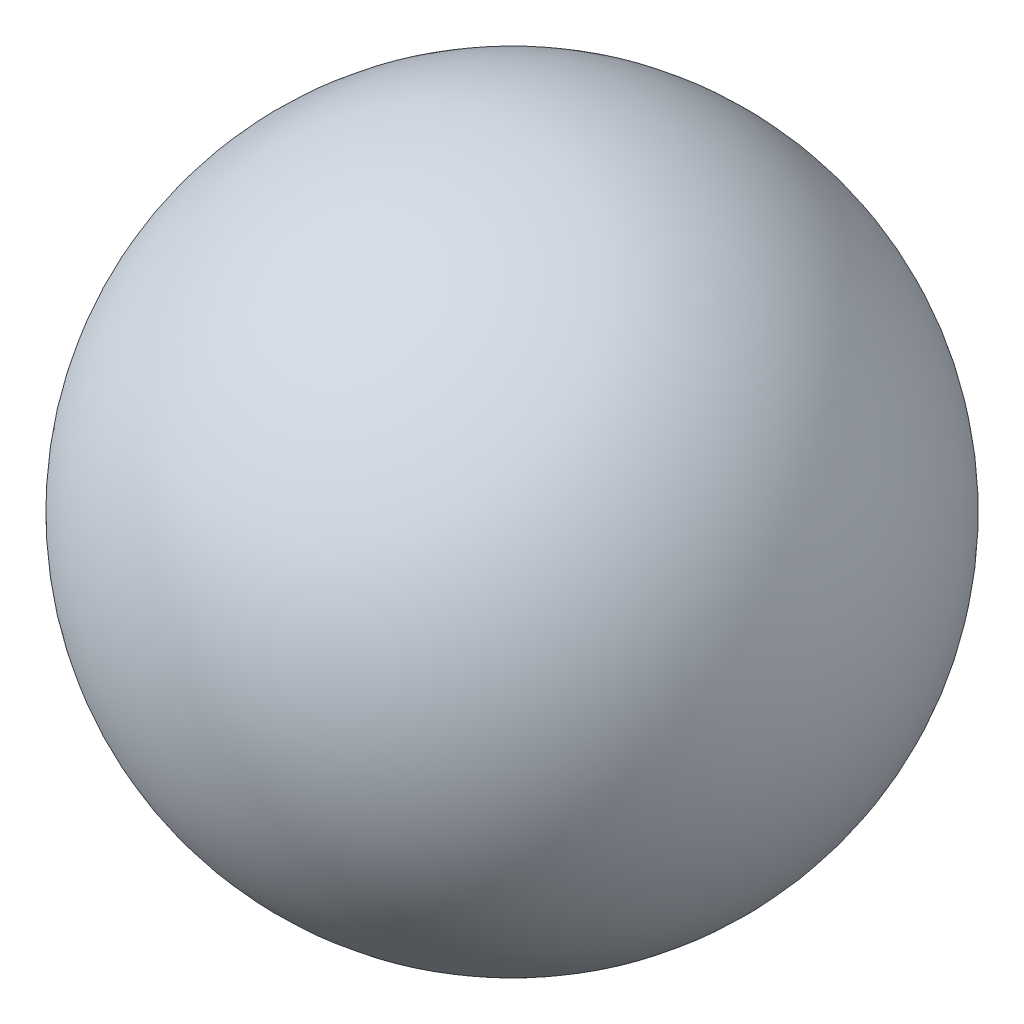
from build123d import *


with BuildPart() as part:
    # ｽｹｯﾁ1 → 回転1 (revolve)
    with BuildSketch(Plane.XY):
        with BuildLine():
            ThreePointArc((0, -115), (115, 0), (0, 115))
            Line((0, 115), (0, -115))
        make_face()
    revolve(axis=Axis((0, 115, 0), (0, -1, 0)))


solid = part.part
